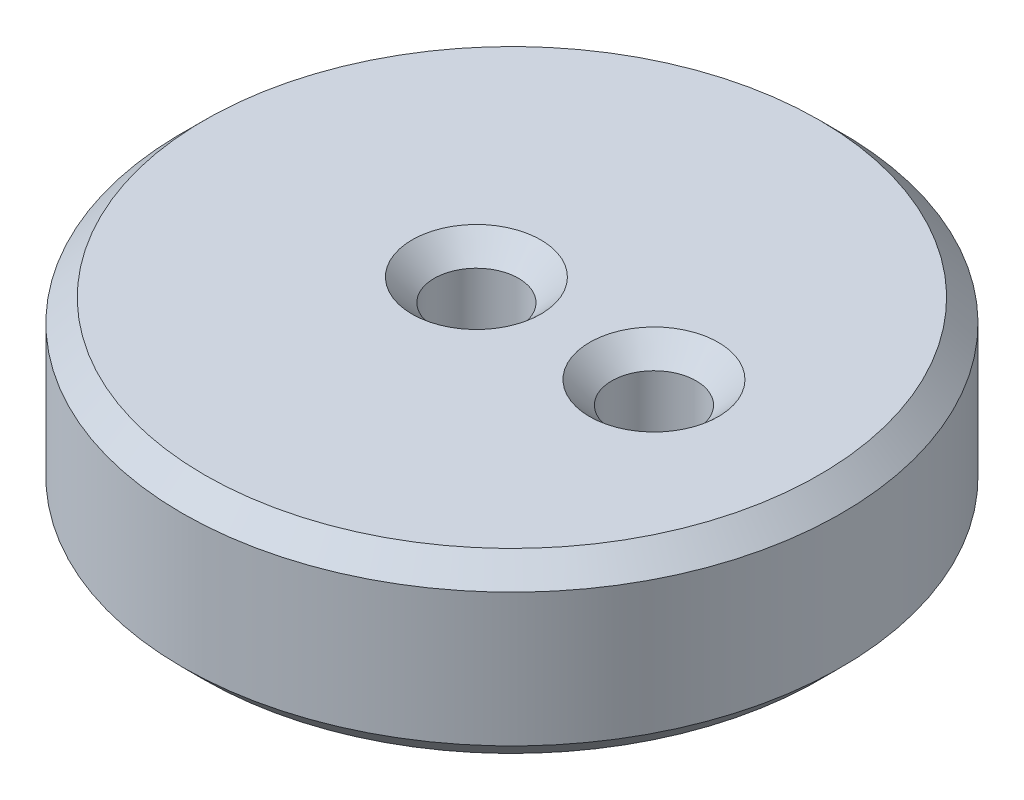
from build123d import *

# Parameters (mm, degrees)
SKETCH_1_R      = 7.425
SKETCH_1_R_2    = 0.95
EXTRUDE_1_DEPTH = 4
CHAMFER_1_SIZE  = 0.5


with BuildPart() as part:
    # 草图1 → 凸台-拉伸1 (new body)
    with BuildSketch(Plane(origin=(0, 0, 0), x_dir=(1, 0, 0), z_dir=(0, 1, 0))):
        Circle(SKETCH_1_R)
        with Locations((3.2, 0)):
            Circle(SKETCH_1_R_2, mode=Mode.SUBTRACT)
        with Locations((-0.8, 0)):
            Circle(SKETCH_1_R_2, mode=Mode.SUBTRACT)
    extrude(amount=EXTRUDE_1_DEPTH)

    # 倒角1
    chamfer_1_edges = [part.edges().sort_by_distance(p)[0] for p in [
        (-7.425, 0, 0),
        (-7.425, 4, 0),
        (-1.75, 0, 0),
        (2.25, 0, 0),
        (-1.75, 4, 0),
        (2.25, 4, 0),
    ]]
    chamfer(chamfer_1_edges, length=CHAMFER_1_SIZE)


solid = part.part
